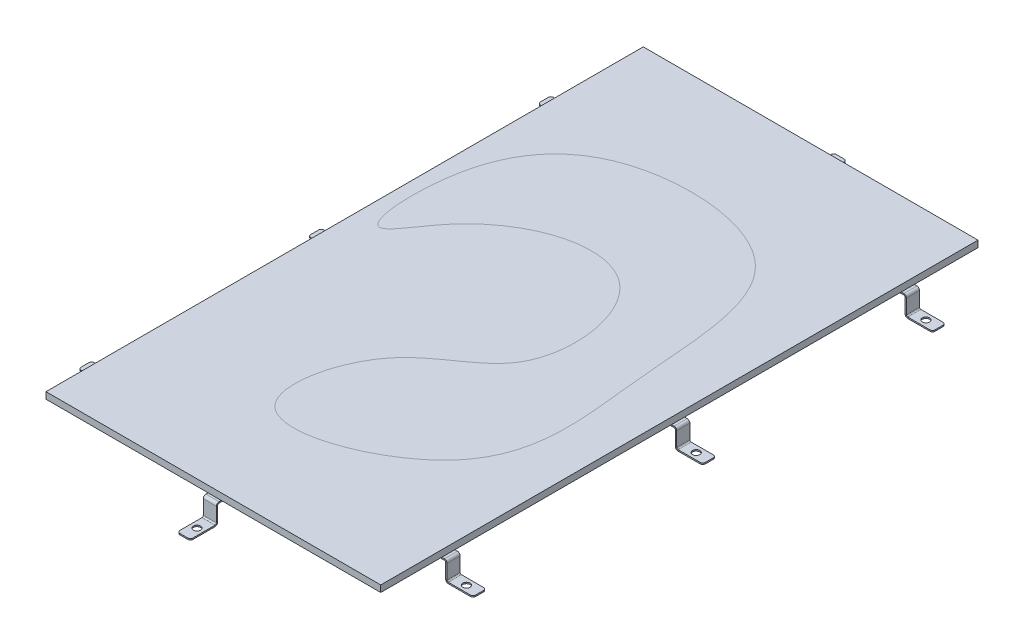
from build123d import *
from build123d.topology import SkipClean

# Parameters (mm, degrees)
BOSS_EXTRUDE1_START         = -20
SKETCH1_W                   = 255
SKETCH1_H                   = 455
BOSS_EXTRUDE1_DEPTH         = 5
SKETCH3_R                   = 2.75
BASE_FLANGE2_DEPTH          = 1
JOG1_START                  = 138.794028937
JOG1_DEPTH                  = 10
JOG1_START_2                = 140.794028937
JOG1_2_DEPTH                = 6
JOG1_START_3                = 72.676617251
JOG1_3_DEPTH                = 1.974011807
JOG1_START_4                = 60.676617251
JOG1_4_OUTLINE_W            = 2
JOG1_4_OUTLINE_H            = 1
JOG1_4_DEPTH                = 12.152182036
JOG1_START_5                = 73.676617251
JOG1_5_DEPTH                = 1
JOG1_6_DEPTH                = 10
JOG1_7_DEPTH                = 10
SKETCH16_R                  = 3.5
BOSS_EXTRUDE2_DEPTH         = 1
BODY_MOVE_COPY3_START       = 74.676617251
BODY_MOVE_COPY3_OUTLINE_R   = 3.5
BODY_MOVE_COPY3_DEPTH       = 1
BODY_MOVE_COPY3_START_2     = 61.676617251
BODY_MOVE_COPY3_2_OUTLINE_W = 10
BODY_MOVE_COPY3_2_OUTLINE_H = 1
BODY_MOVE_COPY3_2_DEPTH     = 11
BODY_MOVE_COPY3_START_3     = 59.676617251
BODY_MOVE_COPY3_3_OUTLINE_R = 2.75
BODY_MOVE_COPY3_3_DEPTH     = 2
BODY_MOVE_COPY3_START_4     = 72.676617251
BODY_MOVE_COPY3_4_OUTLINE_R = 2.75
BODY_MOVE_COPY3_4_DEPTH     = 2
BODY_MOVE_COPY3_START_5     = 138.794028937
BODY_MOVE_COPY3_5_DEPTH     = 10
BODY_MOVE_COPY4_ANGLE       = 90
BODY_MOVE_COPY4_2_ANGLE     = 90
LPATTERN1_COUNT             = 2
LPATTERN1_PITCH             = 175


with BuildPart() as part:
    # Sketch1 → Boss-Extrude1 (new body)
    with BuildSketch(Plane.XZ.offset(-60.676617251).offset(BOSS_EXTRUDE1_START)):
        with Locations((143.794028937, -55.800739351)):
            Rectangle(SKETCH1_W, SKETCH1_H)
    extrude(amount=BOSS_EXTRUDE1_DEPTH)


with BuildPart() as body_2:
    # Base-Flange2: sheet metal written as solids
    # Sketch3 → Base-Flange2 (new body)
    with BuildSketch(Plane.XZ.offset(-60.676617251)):
        with BuildLine():
            Line((140.794028937, 194.199260649), (146.794028937, 194.199260649))
            ThreePointArc((146.794028937, 194.199260649), (148.208242499, 193.613474211), (148.794028937, 192.199260649))
            Line((148.794028937, 192.199260649), (148.794028937, 162.199260649))
            ThreePointArc((148.794028937, 162.199260649), (148.208242499, 160.785047086), (146.794028937, 160.199260649))
            Line((146.794028937, 160.199260649), (140.794028937, 160.199260649))
            ThreePointArc((140.794028937, 160.199260649), (139.379815375, 160.785047086), (138.794028937, 162.199260649))
            Line((138.794028937, 162.199260649), (138.794028937, 192.199260649))
            ThreePointArc((138.794028937, 192.199260649), (139.379815375, 193.613474211), (140.794028937, 194.199260649))
        make_face()
        with Locations((143.794028937, 184.199260649)):
            Circle(SKETCH3_R, mode=Mode.SUBTRACT)
    extrude(amount=BASE_FLANGE2_DEPTH)

    # Jog1: read off the stored shape, not the designer's step
    # Jog1 outline → Jog1 (cut)
    with BuildSketch(Plane.YZ.offset(JOG1_START)):
        with BuildLine():
            Line((60.676617251, 160.199260649), (60.676617251, 173.645307086))
            ThreePointArc((60.676617251, 173.645307086), (59.944566443, 174.377357894), (59.676617251, 175.377357894))
            Line((59.676617251, 175.377357894), (59.676617251, 160.199260649))
            Line((59.676617251, 160.199260649), (60.676617251, 160.199260649))
        make_face()
    extrude(amount=JOG1_DEPTH, mode=Mode.SUBTRACT)

    # Jog1 2 outline → Jog1 2 (add)
    with BuildSketch(Plane.YZ.offset(JOG1_START_2)):
        with BuildLine():
            ThreePointArc((74.676617251, 172.377357894), (74.090830813, 173.791571456), (72.676617251, 174.377357894))
            Line((72.676617251, 174.377357894), (61.676617251, 174.377357894))
            ThreePointArc((61.676617251, 174.377357894), (60.96951047, 174.670251113), (60.676617251, 175.377357894))
            Line((60.676617251, 175.377357894), (60.676617251, 173.645307086))
            ThreePointArc((60.676617251, 173.645307086), (61.158979161, 173.445506241), (61.676617251, 173.377357894))
            Line((61.676617251, 173.377357894), (72.676617251, 173.377357894))
            ThreePointArc((72.676617251, 173.377357894), (73.383724032, 173.084464675), (73.676617251, 172.377357894))
            Line((73.676617251, 172.377357894), (73.676617251, 160.199260649))
            Line((73.676617251, 160.199260649), (74.676617251, 160.199260649))
            Line((74.676617251, 160.199260649), (74.676617251, 172.377357894))
        make_face()
    extrude(amount=JOG1_2_DEPTH)

    # Jog1 3 outline → Jog1 3 (add)
    with BuildSketch(Plane(origin=(0, 0, 0), x_dir=(1, 0, 0), z_dir=(0, 1, 0)).offset(JOG1_START_3)):
        with BuildLine():
            Line((138.794028937, -174.377357894), (140.794028937, -174.377357894))
            Line((140.794028937, -174.377357894), (140.794028937, -160.199260649))
            ThreePointArc((140.794028937, -160.199260649), (139.379815374, -160.785047086), (138.794028937, -162.199260649))
            Line((138.794028937, -162.199260649), (138.794028937, -174.377357894))
        make_face()
        with BuildLine():
            Line((146.794028937, -174.377357894), (148.794028937, -174.377357894))
            Line((148.794028937, -174.377357894), (148.794028937, -162.199260649))
            ThreePointArc((148.794028937, -162.199260649), (148.208242499, -160.785047087), (146.794028937, -160.199260649))
            Line((146.794028937, -160.199260649), (146.794028937, -174.377357894))
        make_face()
    extrude(amount=JOG1_3_DEPTH)

    # Jog1 4 outline → Jog1 4 (add)
    with BuildSketch(Plane(origin=(0, 0, 0), x_dir=(1, 0, 0), z_dir=(0, 1, 0)).offset(JOG1_START_4)):
        with Locations((139.794028937, -173.877357894)):
            Rectangle(JOG1_4_OUTLINE_W, JOG1_4_OUTLINE_H)
        with Locations((147.794028937, -173.877357894)):
            Rectangle(JOG1_4_OUTLINE_W, JOG1_4_OUTLINE_H)
    extrude(amount=JOG1_4_DEPTH)

    # Jog1 5 outline → Jog1 5 (add)
    with BuildSketch(Plane(origin=(0, 0, 0), x_dir=(1, 0, 0), z_dir=(0, 1, 0)).offset(JOG1_START_5)):
        with BuildLine():
            Line((138.794028937, -162.199260649), (138.794028937, -173.377357894))
            Line((138.794028937, -173.377357894), (140.794028937, -173.377357894))
            Line((140.794028937, -173.377357894), (140.794028937, -160.199260649))
            ThreePointArc((140.794028937, -160.199260649), (139.379815374, -160.785047086), (138.794028937, -162.199260649))
        make_face()
        with BuildLine():
            Line((146.794028937, -160.199260649), (146.794028937, -173.377357894))
            Line((146.794028937, -173.377357894), (148.794028937, -173.377357894))
            Line((148.794028937, -173.377357894), (148.794028937, -162.199260649))
            ThreePointArc((148.794028937, -162.199260649), (148.208242499, -160.785047087), (146.794028937, -160.199260649))
        make_face()
    extrude(amount=JOG1_5_DEPTH)

    # Jog1 6 outline → Jog1 6 (cut)
    with SkipClean():  # the faces are left unmerged after this step: merging them gives an invalid solid
        with BuildSketch(Plane.YZ.offset(JOG1_START)):
            with BuildLine():
                Line((73.676617251, 159), (73.676617251, 172.377357894))
                ThreePointArc((73.676617251, 172.377357894), (73.383724032, 173.084464675), (72.676617251, 173.377357894))
                Line((72.676617251, 173.377357894), (61.676617251, 173.377357894))
                ThreePointArc((61.676617251, 173.377357894), (61.158979161, 173.445506241), (60.676617251, 173.645307086))
                ThreePointArc((60.676617251, 173.645307086), (60.262403687, 173.963144333), (59.944566441, 174.377357898))
                Line((59.944566441, 174.377357898), (59, 174.377357903))
                Line((59, 174.377357903), (59, 159))
                Line((59, 159), (73.676617251, 159))
            make_face()
            with BuildLine():
                Line((74.676617251, 173.377357894), (74.650629058, 173.377357894))
                Line((74.650629058, 173.377357894), (74.650629058, 174.377357894))
                Line((74.650629058, 174.377357894), (72.676617251, 174.377357894))
                ThreePointArc((72.676617251, 174.377357894), (74.090830813, 173.791571456), (74.676617251, 172.377357894))
                Line((74.676617251, 172.377357894), (74.67661726, 159))
                Line((74.67661726, 159), (76, 159))
                Line((76, 159), (76, 173.377357897))
                Line((76, 173.377357897), (74.676617251, 173.377357894))
            make_face()
        extrude(amount=JOG1_6_DEPTH, mode=Mode.SUBTRACT)
    add(body_2.part.scale(1), mode=Mode.REPLACE)  # the faces are merged on a copy

    # Jog1 7 outline → Jog1 7 (add)
    with BuildSketch(Plane.YZ.offset(JOG1_START)):
        with BuildLine():
            ThreePointArc((59.676617251, 175.377357894), (59.744765598, 174.859719806), (59.944566441, 174.377357898))
            Line((59.944566441, 174.377357898), (60.676617251, 174.377357902))
            Line((60.676617251, 174.377357902), (61.676617251, 174.377357894))
            ThreePointArc((61.676617251, 174.377357894), (60.96951047, 174.670251113), (60.676617251, 175.377357894))
            Line((60.676617251, 175.377357894), (60.67661725, 177))
            Line((60.67661725, 177), (59.676617251, 177))
            Line((59.676617251, 177), (59.676617251, 175.377357894))
        make_face()
    extrude(amount=JOG1_7_DEPTH)


with BuildPart() as body_3:
    # Sketch16 → Boss-Extrude2 (new body)
    with BuildSketch(Plane(origin=(0, 74.676617251, 0), x_dir=(-1, 0, 0), z_dir=(0, 1, 0))):
        with Locations((-143.794028937, 165.199260649)):
            Circle(SKETCH16_R)
    extrude(amount=BOSS_EXTRUDE2_DEPTH)


with BuildPart() as body_4:
    # Mirror1: mirrored copy
    add(body_2.part.mirror(Plane.XY.offset(-55.800739351)))


with BuildPart() as body_5:
    # Mirror1 2: mirrored copy
    add(body_3.part.mirror(Plane.XY.offset(-55.800739351)))


with BuildPart() as body_6:
    # Body-Move/Copy3: read off the stored shape, not the designer's step
    # Body-Move/Copy3 outline → Body-Move/Copy3 (new body)
    with BuildSketch(Plane(origin=(0, 0, 0), x_dir=(1, 0, 0), z_dir=(0, 1, 0)).offset(BODY_MOVE_COPY3_START)):
        with Locations((143.794028937, 276.800739351)):
            Circle(BODY_MOVE_COPY3_OUTLINE_R)
    extrude(amount=BODY_MOVE_COPY3_DEPTH)


with BuildPart() as body_7:
    # Body-Move_Copy3 2 outline → Body-Move_Copy3 2 (new body)
    with BuildSketch(Plane(origin=(0, 0, 0), x_dir=(1, 0, 0), z_dir=(0, 1, 0)).offset(BODY_MOVE_COPY3_START_2)):
        with Locations((143.794028937, 285.478836596)):
            Rectangle(BODY_MOVE_COPY3_2_OUTLINE_W, BODY_MOVE_COPY3_2_OUTLINE_H)
    extrude(amount=BODY_MOVE_COPY3_2_DEPTH)

    # Body-Move_Copy3 3 outline → Body-Move_Copy3 3 (add)
    with BuildSketch(Plane(origin=(0, 0, 0), x_dir=(1, 0, 0), z_dir=(0, 1, 0)).offset(BODY_MOVE_COPY3_START_3)):
        with BuildLine():
            Line((148.794028937, 273.800739351), (148.794028937, 303.800739351))
            ThreePointArc((148.794028937, 303.800739351), (148.208242499, 305.214952913), (146.794028937, 305.800739351))
            Line((146.794028937, 305.800739351), (140.794028937, 305.800739351))
            ThreePointArc((140.794028937, 305.800739351), (139.379815375, 305.214952913), (138.794028937, 303.800739351))
            Line((138.794028937, 303.800739351), (138.794028937, 273.800739351))
            ThreePointArc((138.794028937, 273.800739351), (139.379815375, 272.386525789), (140.794028937, 271.800739351))
            Line((140.794028937, 271.800739351), (146.794028937, 271.800739351))
            ThreePointArc((146.794028937, 271.800739351), (148.208242499, 272.386525789), (148.794028937, 273.800739351))
        make_face()
        with Locations((143.794028937, 295.800739351)):
            Circle(BODY_MOVE_COPY3_3_OUTLINE_R, mode=Mode.SUBTRACT)
    extrude(amount=BODY_MOVE_COPY3_3_DEPTH)

    # Body-Move_Copy3 4 outline → Body-Move_Copy3 4 (add)
    with BuildSketch(Plane(origin=(0, 0, 0), x_dir=(1, 0, 0), z_dir=(0, 1, 0)).offset(BODY_MOVE_COPY3_START_4)):
        with BuildLine():
            Line((148.794028937, 273.800739351), (148.794028937, 303.800739351))
            ThreePointArc((148.794028937, 303.800739351), (148.208242499, 305.214952913), (146.794028937, 305.800739351))
            Line((146.794028937, 305.800739351), (140.794028937, 305.800739351))
            ThreePointArc((140.794028937, 305.800739351), (139.379815375, 305.214952913), (138.794028937, 303.800739351))
            Line((138.794028937, 303.800739351), (138.794028937, 273.800739351))
            ThreePointArc((138.794028937, 273.800739351), (139.379815375, 272.386525789), (140.794028937, 271.800739351))
            Line((140.794028937, 271.800739351), (146.794028937, 271.800739351))
            ThreePointArc((146.794028937, 271.800739351), (148.208242499, 272.386525789), (148.794028937, 273.800739351))
        make_face()
        with Locations((143.794028937, 295.800739351)):
            Circle(BODY_MOVE_COPY3_4_OUTLINE_R, mode=Mode.SUBTRACT)
    extrude(amount=BODY_MOVE_COPY3_4_DEPTH)

    # Body-Move_Copy3 5 outline → Body-Move_Copy3 5 (cut)
    with BuildSketch(Plane.YZ.offset(BODY_MOVE_COPY3_START_5)):
        with BuildLine():
            Line((72.676617251, -271.800739351), (72.676617251, -284.978836596))
            ThreePointArc((72.676617251, -284.978836596), (73.383724032, -284.685943377), (73.676617251, -283.978836596))
            Line((73.676617251, -283.978836596), (73.676617251, -271.800739351))
            Line((73.676617251, -271.800739351), (72.676617251, -271.800739351))
        make_face()
        with BuildLine():
            Line((74.676617251, -305.800739351), (74.676617251, -283.978836596))
            ThreePointArc((74.676617251, -283.978836596), (74.090830813, -285.393050158), (72.676617251, -285.978836596))
            Line((72.676617251, -285.978836596), (72.676617251, -305.800739351))
            Line((72.676617251, -305.800739351), (74.676617251, -305.800739351))
        make_face()
        with BuildLine():
            Line((60.676617251, -286.978836596), (60.676617251, -305.800739351))
            Line((60.676617251, -305.800739351), (61.676617251, -305.800739351))
            Line((61.676617251, -305.800739351), (61.676617251, -285.978836596))
            ThreePointArc((61.676617251, -285.978836596), (60.96951047, -286.271729815), (60.676617251, -286.978836596))
        make_face()
        with BuildLine():
            Line((59.676617251, -271.800739351), (59.676617251, -286.978836596))
            ThreePointArc((59.676617251, -286.978836596), (60.262403689, -285.564623034), (61.676617251, -284.978836596))
            Line((61.676617251, -284.978836596), (61.676617251, -271.800739351))
            Line((61.676617251, -271.800739351), (59.676617251, -271.800739351))
        make_face()
    extrude(amount=BODY_MOVE_COPY3_5_DEPTH, mode=Mode.SUBTRACT)


with BuildPart() as body_4_1:
    # Body-Move/Copy4: read off the stored shape, not the designer's step
    # Body-Move/Copy4: moved
    add(body_4.part.moved(Location((87.0067104, 0, 299.2728655))).rotate(Axis((0, 0, 0), (0, 1, 0)), BODY_MOVE_COPY4_ANGLE))


with BuildPart() as body_5_1:
    # Body-Move_Copy4 2: moved
    add(body_5.part.moved(Location((87.0067104, 0, 299.2728655))).rotate(Axis((0, 0, 0), (0, 1, 0)), BODY_MOVE_COPY4_2_ANGLE))


with BuildPart() as body_8:
    # Mirror2: mirrored copy
    add(body_4_1.part.mirror(Plane.XY.offset(-55.800739351)))


with BuildPart() as body_9:
    # Mirror2 2: mirrored copy
    add(body_5_1.part.mirror(Plane.XY.offset(-55.800739351)))


with BuildPart() as lpattern1_1:
    # LPattern1: pattern copy
    add(body_5_1.part.moved(Location(Vector(0, 0, 1) * (1 * LPATTERN1_PITCH))))


with BuildPart() as lpattern1_2:
    # LPattern1: pattern copy
    add(body_4_1.part.moved(Location(Vector(0, 0, 1) * (1 * LPATTERN1_PITCH))))


with BuildPart() as body_12:
    # Mirror3: mirrored copy
    add(body_4_1.part.mirror(Plane(origin=(143.794028937, 0, 0), x_dir=(0, 0, 1), z_dir=(1, 0, 0))))


with BuildPart() as body_13:
    # Mirror3 2: mirrored copy
    add(body_5_1.part.mirror(Plane(origin=(143.794028937, 0, 0), x_dir=(0, 0, 1), z_dir=(1, 0, 0))))


with BuildPart() as body_14:
    # Mirror3 3: mirrored copy
    add(lpattern1_2.part.mirror(Plane(origin=(143.794028937, 0, 0), x_dir=(0, 0, 1), z_dir=(1, 0, 0))))


with BuildPart() as body_15:
    # Mirror3 4: mirrored copy
    add(lpattern1_1.part.mirror(Plane(origin=(143.794028937, 0, 0), x_dir=(0, 0, 1), z_dir=(1, 0, 0))))


with BuildPart() as body_16:
    # Mirror3 5: mirrored copy
    add(body_8.part.mirror(Plane(origin=(143.794028937, 0, 0), x_dir=(0, 0, 1), z_dir=(1, 0, 0))))


with BuildPart() as body_17:
    # Mirror3 6: mirrored copy
    add(body_9.part.mirror(Plane(origin=(143.794028937, 0, 0), x_dir=(0, 0, 1), z_dir=(1, 0, 0))))


solid = Compound([part.part, body_2.part, body_3.part, body_6.part, body_7.part, body_4_1.part, body_5_1.part, body_8.part, body_9.part, lpattern1_1.part, lpattern1_2.part, body_12.part, body_13.part, body_14.part, body_15.part, body_16.part, body_17.part])
